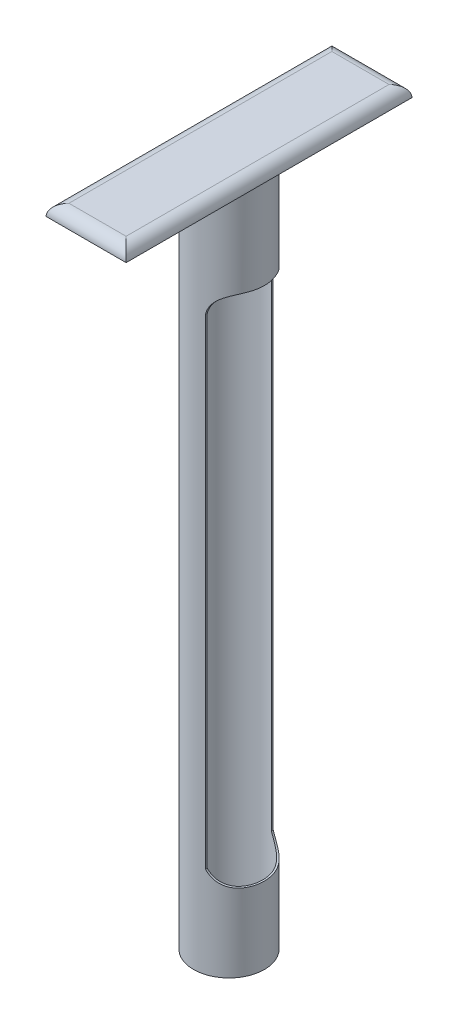
from build123d import *

# Parameters (mm, degrees)
SKETCH1_R               = 15.5
SKETCH1_R_2             = 14.75
BOSS_EXTRUDE1_DEPTH     = 300
SKETCH4_W               = 35
SKETCH4_H               = 125
BOSS_EXTRUDE2_DEPTH     = 5
CUT_EXTRUDE2_DEPTH      = 50
CUT_EXTRUDE2_DEPTH_BACK = 40
FILLET2_R               = 5


with BuildPart() as part:
    # Sketch1 → Boss-Extrude1 (new body)
    with BuildSketch(Plane(origin=(0, 0, 0), x_dir=(1, 0, 0), z_dir=(0, 1, 0))):
        with Locations(Location((0, 0, 0), (0, 0, 270))):
            Circle(SKETCH1_R)
        with Locations(Location((0, 0, 0), (0, 0, 270))):
            Circle(SKETCH1_R_2, mode=Mode.SUBTRACT)
    extrude(amount=BOSS_EXTRUDE1_DEPTH)

    # Sketch4 → Boss-Extrude2 (add)
    with BuildSketch(Plane(origin=(0, 300, 0), x_dir=(1, 0, 0), z_dir=(0, 1, 0))):
        Rectangle(SKETCH4_W, SKETCH4_H)
    extrude(amount=BOSS_EXTRUDE2_DEPTH)

    # Sketch2 → Cut-Extrude2 (cut, two sides: drawn at the far end of the back side and taken through both)
    with BuildSketch(Plane.XY.offset(-CUT_EXTRUDE2_DEPTH_BACK)):
        with BuildLine():
            Line((15.5, 33.559719433), (15.5, 259.086340433))
            ThreePointArc((15.5, 259.086340433), (8.366249541, 256.521002237), (4.5, 250))
            Line((4.5, 250), (4.5, 40))
            ThreePointArc((4.5, 40), (9.126672498, 35.288216236), (15.5, 33.559719433))
        make_face()
    extrude(amount=CUT_EXTRUDE2_DEPTH + CUT_EXTRUDE2_DEPTH_BACK, mode=Mode.SUBTRACT)

    # Fillet2
    fillet2_edges = [part.edges().sort_by_distance(p)[0] for p in [
        (0, 305, -62.5),
        (0, 305, 62.5),
        (-17.5, 305, 0),
        (17.5, 305, 0),
    ]]
    fillet(fillet2_edges, radius=FILLET2_R - 0.0001)  # a hair under: the kernel refuses the full size


solid = part.part
